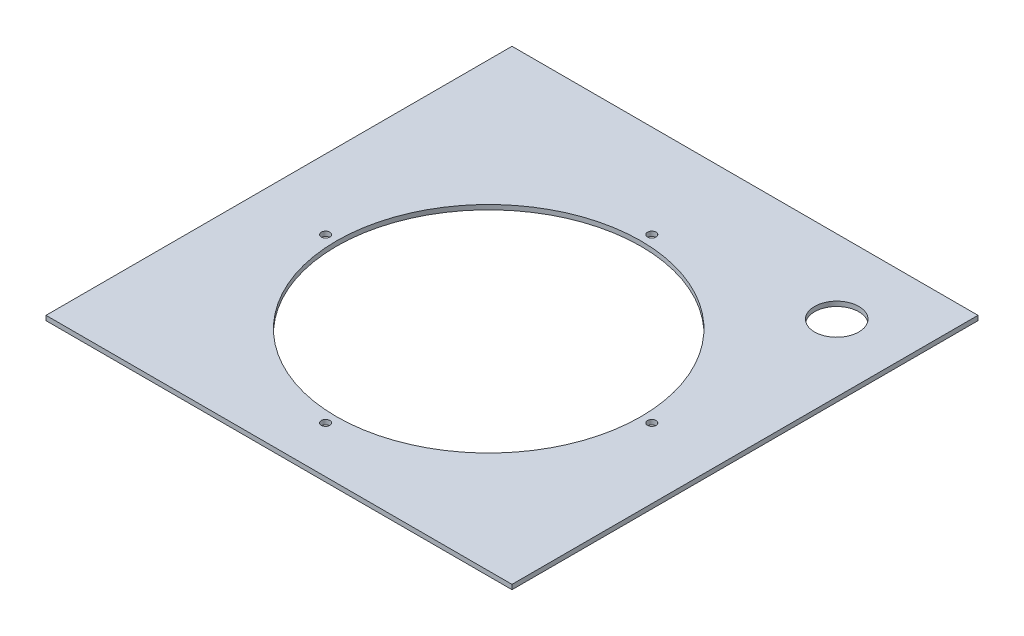
from build123d import *

# Parameters (mm, degrees)
SKETCH1_W           = 300
SKETCH1_H           = 330
BOSS_EXTRUDE1_DEPTH = 3
CUT_EXTRUDE1_REACH  = 447.992
SKETCH2_R           = 98
SKETCH2_R_2         = 14.255
SKETCH4_R           = 2.75
CUT_EXTRUDE3_DEPTH  = 446.992152397
SKETCH6_W           = 300
SKETCH6_H           = 30
CUT_EXTRUDE5_DEPTH  = 446.992152397


with BuildPart() as part:
    # Sketch1 → Boss-Extrude1 (new body)
    with BuildSketch(Plane(origin=(0, 0, 0), x_dir=(1, 0, 0), z_dir=(0, 1, 0))):
        with Locations((150, -165)):
            Rectangle(SKETCH1_W, SKETCH1_H)
    extrude(amount=BOSS_EXTRUDE1_DEPTH)

    # Sketch2 → Cut-Extrude1 (cut, up to next)
    with BuildSketch(Plane(origin=(0, 3, 0), x_dir=(1, 0, 0), z_dir=(0, 1, 0)), mode=Mode.PRIVATE) as cut_extrude1_sk1:
        with Locations((150, -165)):
            Circle(SKETCH2_R)
    cut_extrude1_tool1 = extrude(cut_extrude1_sk1.sketch, amount=-CUT_EXTRUDE1_REACH, mode=Mode.PRIVATE) & part.part
    # Sketch2 → Cut-Extrude1 (cut, up to next)
    with BuildSketch(Plane(origin=(0, 3, 0), x_dir=(1, 0, 0), z_dir=(0, 1, 0)), mode=Mode.PRIVATE) as cut_extrude1_sk2:
        with Locations((256.685905128, -47.645504359)):
            Circle(SKETCH2_R_2)
    cut_extrude1_tool2 = extrude(cut_extrude1_sk2.sketch, amount=-CUT_EXTRUDE1_REACH, mode=Mode.PRIVATE) & part.part
    add(cut_extrude1_tool1.solids().sort_by_distance((150, 3, 165))[0], mode=Mode.SUBTRACT)
    add(cut_extrude1_tool2.solids().sort_by_distance((256.685905, 3, 47.645504))[0], mode=Mode.SUBTRACT)

    # Sketch4 → Cut-Extrude3 (cut, through all)
    with BuildSketch(Plane(origin=(0, 3, 0), x_dir=(1, 0, 0), z_dir=(0, 1, 0))):
        with Locations((45, -165)):
            Circle(SKETCH4_R)
        with Locations((255, -165)):
            Circle(SKETCH4_R)
        with Locations((150, -270)):
            Circle(SKETCH4_R)
        with Locations((150, -60)):
            Circle(SKETCH4_R)
    extrude(amount=-CUT_EXTRUDE3_DEPTH, mode=Mode.SUBTRACT)

    # Sketch6 → Cut-Extrude5 (cut, through all)
    with BuildSketch(Plane(origin=(0, 3, 0), x_dir=(1, 0, 0), z_dir=(0, 1, 0))):
        with Locations((150, -315)):
            Rectangle(SKETCH6_W, SKETCH6_H)
    extrude(amount=-CUT_EXTRUDE5_DEPTH, mode=Mode.SUBTRACT)


solid = part.part
